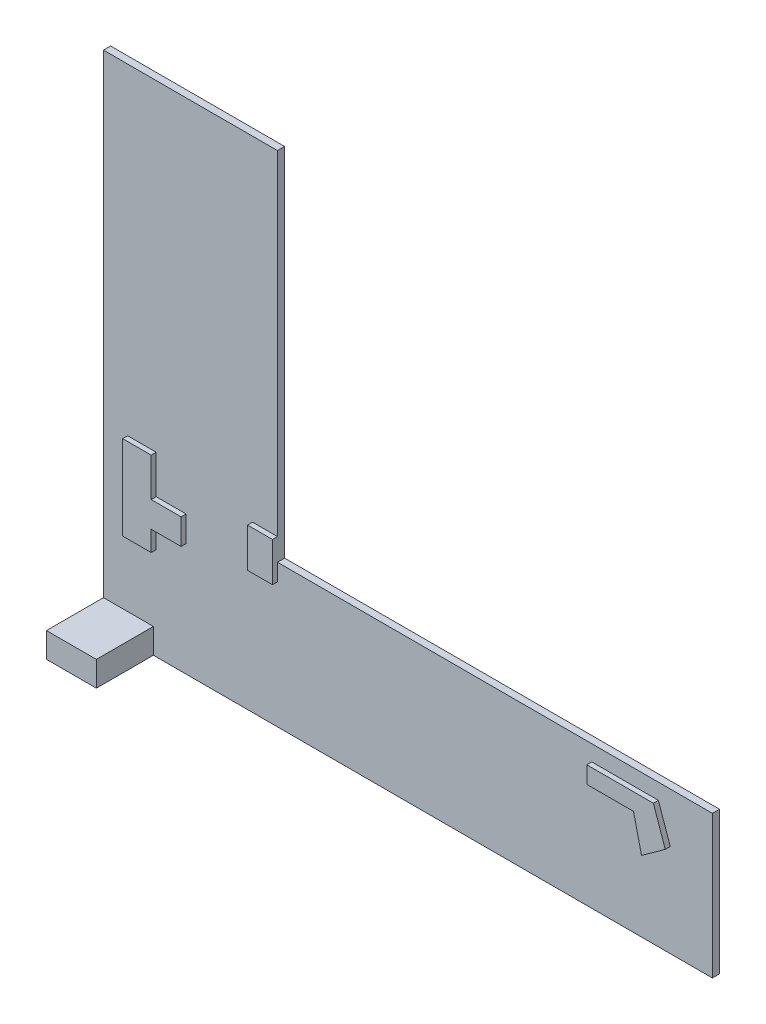
from build123d import *

# Parameters (mm, degrees)
BOSS_EXTRUDE4_DEPTH  = 10
SKETCH3_W            = 70
SKETCH3_H            = 35
BOSS_EXTRUDE6_DEPTH  = 80
SKETCH9_W            = 35
SKETCH9_H            = 55
BOSS_EXTRUDE7_DEPTH  = 7
SKETCH11_W           = 40
SKETCH11_H           = 118.358455864
SKETCH11_W_2         = 41.95386811
SKETCH11_H_2         = 35.992720424
BOSS_EXTRUDE9_DEPTH  = 7
BOSS_EXTRUDE10_DEPTH = 7


with BuildPart() as part:
    # Sketch1 → Boss-Extrude4 (new body)
    with BuildSketch(Plane.XY):
        Polygon((0, 700), (0, 0), (854, 0), (854, 200), (244, 200), (244, 700), align=None)
    extrude(amount=BOSS_EXTRUDE4_DEPTH)

    # Sketch3 → Boss-Extrude6 (add)
    with BuildSketch(Plane.XY.offset(10)):
        with Locations((35, 17.5)):
            Rectangle(SKETCH3_W, SKETCH3_H)
    extrude(amount=BOSS_EXTRUDE6_DEPTH)

    # Sketch9 → Boss-Extrude7 (add)
    with BuildSketch(Plane.XY.offset(10)):
        with Locations((226.5, 203.653439069)):
            Rectangle(SKETCH9_W, SKETCH9_H)
    extrude(amount=BOSS_EXTRUDE7_DEPTH)

    # Sketch11 → Boss-Extrude9 (add)
    with BuildSketch(Plane.XY.offset(10)):
        with Locations((53.865250204, 189.360484433)):
            Rectangle(SKETCH11_W, SKETCH11_H)
        with Locations((94.842184259, 176.53538256)):
            Rectangle(SKETCH11_W_2, SKETCH11_H_2)
    extrude(amount=BOSS_EXTRUDE9_DEPTH)

    # Sketch12 → Boss-Extrude10 (add)
    with BuildSketch(Plane.XY.offset(10)):
        Polygon((750.330379626, 154.096028842), (761.599794246, 106.255879963), (794.862821747, 130.175954403), (778.231307997, 177.889322802), (750.330379626, 177.889322802), (684.810676826, 177.889322802), (684.810676826, 154.096028842), align=None)
    extrude(amount=BOSS_EXTRUDE10_DEPTH)


solid = part.part
